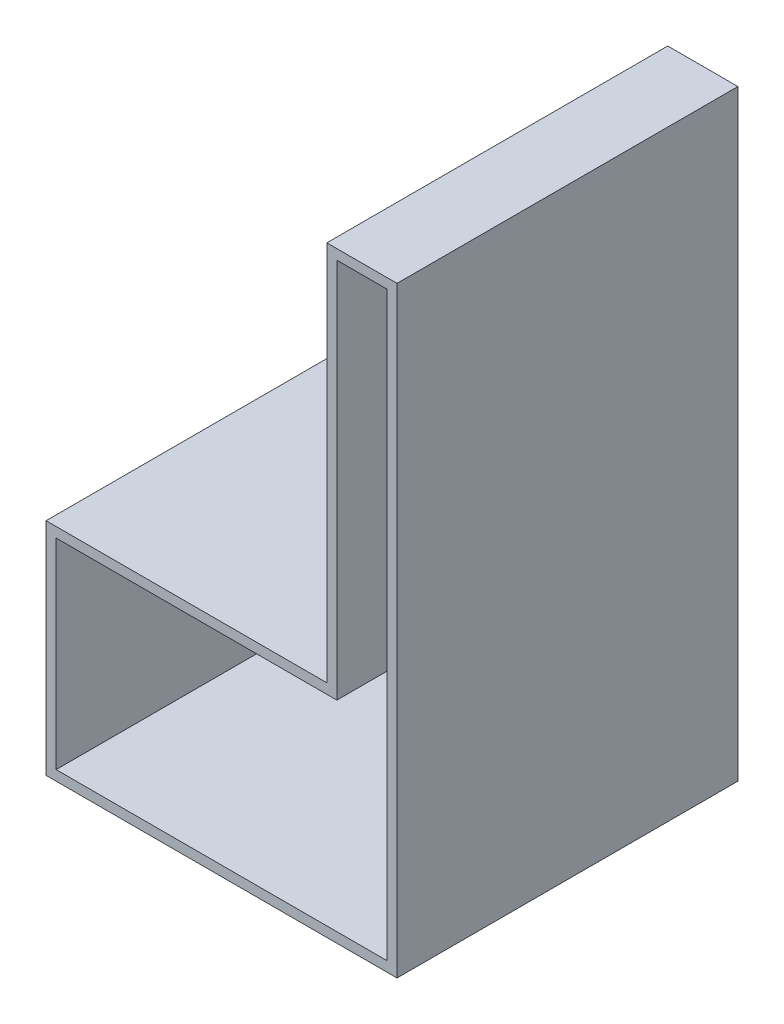
from build123d import *

# Parameters (mm, degrees)
EXTRUDE_1_DEPTH = 170
SHELL_1_T       = -5


with BuildPart() as part:
    # ｽｹｯﾁ2 → ﾎﾞｽ - 押し出し1 (new body)
    with BuildSketch(Plane.XY):
        Polygon((0, 0), (0, 190), (35, 190), (35, -110), (-140, -110), (-140, 0), align=None)
    extrude(amount=EXTRUDE_1_DEPTH)

    # ｼｪﾙ1
    shell_1_openings = [part.faces().sort_by_distance(p)[0] for p in [
        (-34.527027027, -16.486486486, 170),
    ]]
    offset(amount=SHELL_1_T, openings=shell_1_openings, kind=Kind.INTERSECTION)


solid = part.part
